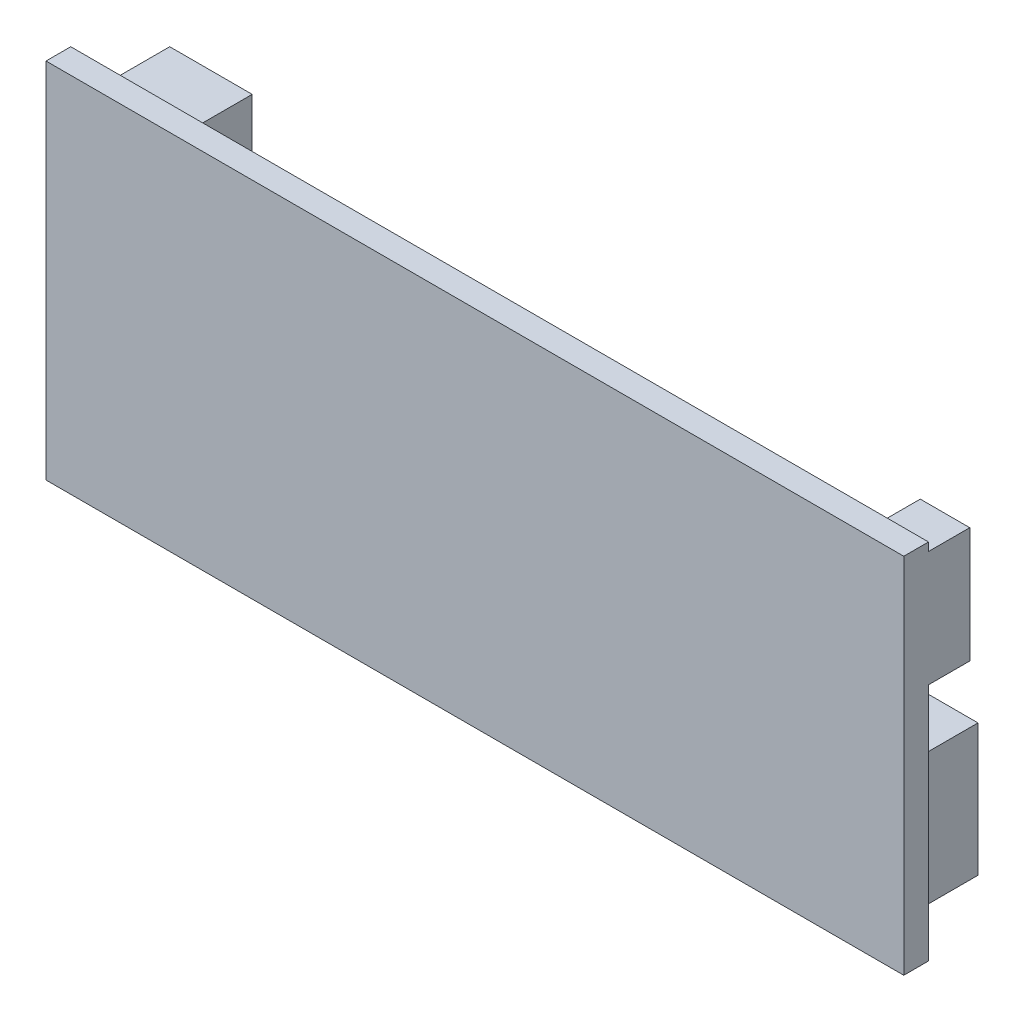
from build123d import *

# Parameters (mm, degrees)
SKETCH1_W           = 52
SKETCH1_H           = 22
BOSS_EXTRUDE1_DEPTH = 1.5
SKETCH2_W           = 5
SKETCH2_H           = 5
SKETCH2_W_2         = 10
SKETCH2_H_2         = 8
SKETCH2_W_3         = 3
SKETCH2_H_3         = 7
SKETCH2_W_4         = 1.5
SKETCH2_H_4         = 4.802137959
BOSS_EXTRUDE2_DEPTH = 2.5
SKETCH3_W           = 10
SKETCH3_H           = 8
SKETCH3_W_2         = 1.5
SKETCH3_H_2         = 4.802137959
SKETCH3_W_3         = 5
SKETCH3_H_3         = 5
BOSS_EXTRUDE3_DEPTH = 2


with BuildPart() as part:
    # Sketch1 → Boss-Extrude1 (new body)
    with BuildSketch(Plane.XY):
        with Locations((6.718487395, 11)):
            Rectangle(SKETCH1_W, SKETCH1_H)
    extrude(amount=BOSS_EXTRUDE1_DEPTH)

    # Sketch2 → Boss-Extrude2 (add)
    with BuildSketch(Plane(origin=(0, 0, 0), x_dir=(-1, 0, 0), z_dir=(0, 0, -1))):
        with Locations((15.281512605, 18)):
            Rectangle(SKETCH2_W, SKETCH2_H)
        with Locations((-26.218487395, 5.5)):
            Rectangle(SKETCH2_W_2, SKETCH2_H_2)
        with Locations((-31.218487395, 18)):
            Rectangle(SKETCH2_W_3, SKETCH2_H_3)
        with Locations((18.531512605, 5.498931021)):
            Rectangle(SKETCH2_W_4, SKETCH2_H_4)
    extrude(amount=BOSS_EXTRUDE2_DEPTH)

    # Sketch3 → Boss-Extrude3 (add)
    with BuildSketch(Plane(origin=(0, 0, -2.5), x_dir=(-1, 0, 0), z_dir=(0, 0, -1))):
        with Locations((-26.218487395, 5.5)):
            Rectangle(SKETCH3_W, SKETCH3_H)
        with Locations((18.531512605, 5.498931021)):
            Rectangle(SKETCH3_W_2, SKETCH3_H_2)
        with Locations((15.281512605, 18)):
            Rectangle(SKETCH3_W_3, SKETCH3_H_3)
    extrude(amount=BOSS_EXTRUDE3_DEPTH)


solid = part.part
